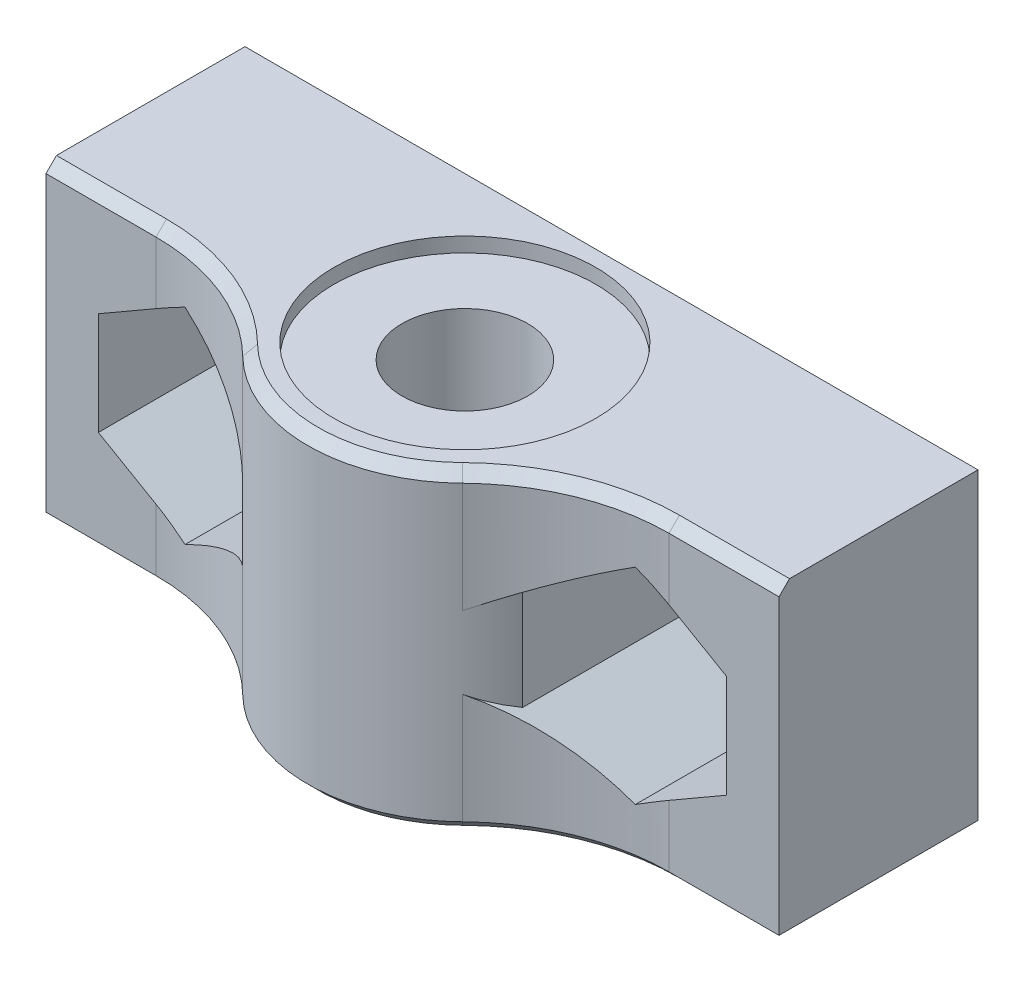
from build123d import *

# Parameters (mm, degrees)
SKETCH1_W           = 35
SKETCH1_H           = 15
BOSS_EXTRUDE1_DEPTH = 10
SKETCH3_R           = 7.5
BOSS_EXTRUDE2_DEPTH = 15
CUT_EXTRUDE1_START  = -7.5
CUT_EXTRUDE1_DEPTH  = 17.5
SKETCH5_R           = 2.75
CUT_EXTRUDE3_DEPTH  = 27.220221204
SKETCH4_R           = 3
CUT_EXTRUDE2_DEPTH  = 28.5
FILLET1_R           = 10
SKETCH6_R           = 6.25
CUT_EXTRUDE4_DEPTH  = 0.7
CUT_EXTRUDE5_START  = -14.3
SKETCH6_3_R         = 6.25
CUT_EXTRUDE5_DEPTH  = 0.7
CHAMFER1_SIZE       = 0.5


with BuildPart() as part:
    # Sketch1 → Boss-Extrude1 (new body)
    with BuildSketch(Plane.XY):
        with Locations((0, -7.5)):
            Rectangle(SKETCH1_W, SKETCH1_H)
    extrude(amount=BOSS_EXTRUDE1_DEPTH)

    # Sketch3 → Boss-Extrude2 (add, through all)
    with BuildSketch(Plane(origin=(0, 0, 0), x_dir=(1, 0, 0), z_dir=(0, 1, 0))):
        with Locations((0, -7.5)):
            Circle(SKETCH3_R)
    extrude(amount=-BOSS_EXTRUDE2_DEPTH)

    # Sketch2 → Cut-Extrude1 (cut)
    with BuildSketch(Plane.XY.offset(10).offset(CUT_EXTRUDE1_START)):
        Polygon((-10.75, -12.407477288), (-6.5, -9.953738644), (-6.5, -5.046261356), (-10.75, -2.592522712), (-15, -5.046261356), (-15, -9.953738644), align=None)
    cut_extrude1 = extrude(amount=CUT_EXTRUDE1_DEPTH, mode=Mode.SUBTRACT)

    # Sketch5 → Cut-Extrude3 (cut, through all)
    with BuildSketch(Plane.XY.offset(2.5)):
        with Locations((-10.75, -7.5)):
            Circle(SKETCH5_R)
    cut_extrude3 = extrude(amount=-CUT_EXTRUDE3_DEPTH, mode=Mode.SUBTRACT)

    # Mirror1: Cut-Extrude1, Cut-Extrude3 across plane
    add(cut_extrude1.mirror(Plane(origin=(0, 0, 0), x_dir=(0, 0, 1), z_dir=(1, 0, 0))), mode=Mode.SUBTRACT)
    add(cut_extrude3.mirror(Plane(origin=(0, 0, 0), x_dir=(0, 0, 1), z_dir=(1, 0, 0))), mode=Mode.SUBTRACT)

    # Sketch4 → Cut-Extrude2 (cut, through all)
    with BuildSketch(Plane(origin=(0, 0, 0), x_dir=(1, 0, 0), z_dir=(0, 1, 0))):
        with Locations(Location((0, -7.5, 0), (0, 0, 180))):
            Circle(SKETCH4_R)
    extrude(amount=-CUT_EXTRUDE2_DEPTH, mode=Mode.SUBTRACT)

    # Fillet1
    # the kernel refuses this fillet: 10 mm, written as the material it adds along each edge
    with BuildSketch(Plane(origin=(7.071067812, -17.657507456, 10), x_dir=(-0.5377110557824625, 0, 0.8431291837490323), z_dir=(0, 1, 0))) as fillet1_piece_1_section:
        with BuildLine():
            CenterArc((5.647894598, 9.741468363), FILLET1_R, 212.527956019, 44.415308597)
            Line((-2.78339724, 4.364357805), (0, 0))
            ThreePointArc((0, 0), (1.694368379, 0.193898728), (3.388736759, 0))
        make_face()
    fillet1_piece_1 = extrude(amount=30.598459711, mode=Mode.PRIVATE)
    fillet1_piece_1 = split(fillet1_piece_1, bisect_by=Plane(origin=(6.425815385, -15, 11.617899052), z_dir=(0, 1, 0)), keep=Keep.TOP, mode=Mode.PRIVATE)
    fillet1_piece_1 = split(fillet1_piece_1, bisect_by=Plane(origin=(8.608682251, -11.17118691, 11.617899052), z_dir=(-0.49999999999999994, -0.8660254037844389, 0)), keep=Keep.TOP, mode=Mode.PRIVATE)
    add(fillet1_piece_1)
    with BuildSketch(Plane(origin=(7.071067812, -17.657507456, 10), x_dir=(-0.5377110557824625, 0, 0.8431291837490323), z_dir=(0, 1, 0))) as fillet1_piece_2_section:
        with BuildLine():
            CenterArc((5.647894598, 9.741468363), FILLET1_R, 212.527956019, 44.415308597)
            Line((-2.78339724, 4.364357805), (0, 0))
            ThreePointArc((0, 0), (1.694368379, 0.193898728), (3.388736759, 0))
        make_face()
    fillet1_piece_2 = extrude(amount=30.598459711, mode=Mode.PRIVATE)
    fillet1_piece_2 = split(fillet1_piece_2, bisect_by=Plane(origin=(11.198944739, -12.666675654, 10.022508618), z_dir=(0.49999999999999994, 0.8660254037844389, 0)), keep=Keep.TOP, mode=Mode.PRIVATE)
    fillet1_piece_2 = split(fillet1_piece_2, bisect_by=Plane(origin=(11.198944739, -12.148278922, 10.022508618), z_dir=(0.49999999999999994, -0.8660254037844389, 0)), keep=Keep.TOP, mode=Mode.PRIVATE)
    add(fillet1_piece_2)
    with BuildSketch(Plane(origin=(7.071067812, -17.657507456, 10), x_dir=(-0.5377110557824625, 0, 0.8431291837490323), z_dir=(0, 1, 0))) as fillet1_piece_3_section:
        with BuildLine():
            CenterArc((5.647894598, 9.741468363), FILLET1_R, 212.527956019, 44.415308597)
            Line((-2.78339724, 4.364357805), (0, 0))
            ThreePointArc((0, 0), (1.694368379, 0.193898728), (3.388736759, 0))
        make_face()
    fillet1_piece_3 = extrude(amount=17.657507456, mode=Mode.PRIVATE)
    fillet1_piece_3 = split(fillet1_piece_3, bisect_by=Plane(origin=(7.311033897, -4.578010717, 11.885204444), z_dir=(-0.5000000000000009, 0.8660254037844383, 0)), keep=Keep.TOP, mode=Mode.PRIVATE)
    add(fillet1_piece_3)
    with BuildSketch(Plane(origin=(7.071067812, -17.657507456, 10), x_dir=(-0.5377110557824625, 0, 0.8431291837490323), z_dir=(0, 1, 0))) as fillet1_piece_4_section:
        with BuildLine():
            CenterArc((5.647894598, 9.741468363), FILLET1_R, 212.527956019, 44.415308597)
            Line((-2.78339724, 4.364357805), (0, 0))
            ThreePointArc((0, 0), (1.694368379, 0.193898728), (3.388736759, 0))
        make_face()
    fillet1_piece_4 = extrude(amount=30.598459711, mode=Mode.PRIVATE)
    fillet1_piece_4 = split(fillet1_piece_4, bisect_by=Plane(origin=(11.198944739, -2.333324346, 10.022508618), z_dir=(0.5000000000000009, -0.8660254037844383, 0)), keep=Keep.TOP, mode=Mode.PRIVATE)
    fillet1_piece_4 = split(fillet1_piece_4, bisect_by=Plane(origin=(11.198944739, -2.851721078, 10.022508618), z_dir=(0.5000000000000001, 0.8660254037844386, 0)), keep=Keep.TOP, mode=Mode.PRIVATE)
    add(fillet1_piece_4)
    with BuildSketch(Plane(origin=(-7.071067812, -17.657507456, 10), x_dir=(-1, 0, 0), z_dir=(0, 1, 0))) as fillet1_piece_5_section:
        with BuildLine():
            CenterArc((5.176380902, 10), FILLET1_R, 225.584691403, 44.415308597)
            ThreePointArc((-1.82216122, 2.857142857), (-0.747598934, 1.532832918), (0, 0))
            Line((0, 0), (5.176380902, 0))
        make_face()
    fillet1_piece_5 = extrude(amount=30.598459711, mode=Mode.PRIVATE)
    fillet1_piece_5 = split(fillet1_piece_5, bisect_by=Plane(origin=(-8.687576495, -15, 10.380647158), z_dir=(0, 1, 0)), keep=Keep.TOP, mode=Mode.PRIVATE)
    fillet1_piece_5 = split(fillet1_piece_5, bisect_by=Plane(origin=(-10.026133402, -11.989552713, 10.380647158), z_dir=(0.49999999999999994, -0.8660254037844389, 0)), keep=Keep.TOP, mode=Mode.PRIVATE)
    add(fillet1_piece_5)
    with BuildSketch(Plane(origin=(-7.071067812, -17.657507456, 10), x_dir=(-1, 0, 0), z_dir=(0, 1, 0))) as fillet1_piece_6_section:
        with BuildLine():
            CenterArc((5.176380902, 10), FILLET1_R, 225.584691403, 44.415308597)
            ThreePointArc((-1.82216122, 2.857142857), (-0.747598934, 1.532832918), (0, 0))
            Line((0, 0), (5.176380902, 0))
        make_face()
    fillet1_piece_6 = extrude(amount=30.598459711, mode=Mode.PRIVATE)
    fillet1_piece_6 = split(fillet1_piece_6, bisect_by=Plane(origin=(-11.19894474, -12.666675654, 10.022508618), z_dir=(-0.49999999999999994, 0.8660254037844389, 0)), keep=Keep.TOP, mode=Mode.PRIVATE)
    fillet1_piece_6 = split(fillet1_piece_6, bisect_by=Plane(origin=(-11.19894474, -12.148278922, 10.022508618), z_dir=(-0.49999999999999994, -0.8660254037844389, 0)), keep=Keep.TOP, mode=Mode.PRIVATE)
    add(fillet1_piece_6)
    with BuildSketch(Plane(origin=(-7.071067812, -17.657507456, 10), x_dir=(-1, 0, 0), z_dir=(0, 1, 0))) as fillet1_piece_7_section:
        with BuildLine():
            CenterArc((5.176380902, 10), FILLET1_R, 225.584691403, 44.415308597)
            ThreePointArc((-1.82216122, 2.857142857), (-0.747598934, 1.532832918), (0, 0))
            Line((0, 0), (5.176380902, 0))
        make_face()
    fillet1_piece_7 = extrude(amount=17.657507456, mode=Mode.PRIVATE)
    fillet1_piece_7 = split(fillet1_piece_7, bisect_by=Plane(origin=(-8.42018253, -3.937643455, 10.662510622), z_dir=(0.5000000000000009, 0.8660254037844383, 0)), keep=Keep.TOP, mode=Mode.PRIVATE)
    add(fillet1_piece_7)
    with BuildSketch(Plane(origin=(-7.071067812, -17.657507456, 10), x_dir=(-1, 0, 0), z_dir=(0, 1, 0))) as fillet1_piece_8_section:
        with BuildLine():
            CenterArc((5.176380902, 10), FILLET1_R, 225.584691403, 44.415308597)
            ThreePointArc((-1.82216122, 2.857142857), (-0.747598934, 1.532832918), (0, 0))
            Line((0, 0), (5.176380902, 0))
        make_face()
    fillet1_piece_8 = extrude(amount=30.598459711, mode=Mode.PRIVATE)
    fillet1_piece_8 = split(fillet1_piece_8, bisect_by=Plane(origin=(-11.19894474, -2.851721078, 10.022508618), z_dir=(-0.5000000000000001, 0.8660254037844386, 0)), keep=Keep.TOP, mode=Mode.PRIVATE)
    fillet1_piece_8 = split(fillet1_piece_8, bisect_by=Plane(origin=(-11.19894474, -2.333324346, 10.022508618), z_dir=(-0.5000000000000009, -0.8660254037844383, 0)), keep=Keep.TOP, mode=Mode.PRIVATE)
    add(fillet1_piece_8)
    with BuildSketch(Plane(origin=(-7.071067812, -15, 10), x_dir=(-1, 0, 0), z_dir=(0, 1, 0))) as fillet1_piece_9_section:
        with BuildLine():
            CenterArc((5.176380902, 10), FILLET1_R, 225.584691403, 44.415308597)
            ThreePointArc((-1.82216122, 2.857142857), (-0.747598934, 1.532832918), (0, 0))
            Line((0, 0), (5.176380902, 0))
        make_face()
    fillet1_piece_9 = extrude(amount=17.657507456, mode=Mode.PRIVATE)
    fillet1_piece_9 = split(fillet1_piece_9, bisect_by=Plane(origin=(-10.026133402, -11.989552713, 10.380647158), z_dir=(0.49999999999999994, -0.8660254037844389, 0)), keep=Keep.TOP, mode=Mode.PRIVATE)
    add(fillet1_piece_9)
    with BuildSketch(Plane(origin=(-7.071067812, -27.940952255, 10), x_dir=(-1, 0, 0), z_dir=(0, 1, 0))) as fillet1_piece_10_section:
        with BuildLine():
            CenterArc((5.176380902, 10), FILLET1_R, 225.584691403, 44.415308597)
            ThreePointArc((-1.82216122, 2.857142857), (-0.747598934, 1.532832918), (0, 0))
            Line((0, 0), (5.176380902, 0))
        make_face()
    fillet1_piece_10 = extrude(amount=30.598459711, mode=Mode.PRIVATE)
    fillet1_piece_10 = split(fillet1_piece_10, bisect_by=Plane(origin=(-11.19894474, -12.666675654, 10.022508618), z_dir=(-0.49999999999999994, 0.8660254037844389, 0)), keep=Keep.TOP, mode=Mode.PRIVATE)
    fillet1_piece_10 = split(fillet1_piece_10, bisect_by=Plane(origin=(-11.19894474, -12.148278922, 10.022508618), z_dir=(-0.49999999999999994, -0.8660254037844389, 0)), keep=Keep.TOP, mode=Mode.PRIVATE)
    add(fillet1_piece_10)
    with BuildSketch(Plane(origin=(-7.071067812, -27.940952255, 10), x_dir=(-1, 0, 0), z_dir=(0, 1, 0))) as fillet1_piece_11_section:
        with BuildLine():
            CenterArc((5.176380902, 10), FILLET1_R, 225.584691403, 44.415308597)
            ThreePointArc((-1.82216122, 2.857142857), (-0.747598934, 1.532832918), (0, 0))
            Line((0, 0), (5.176380902, 0))
        make_face()
    fillet1_piece_11 = extrude(amount=30.598459711, mode=Mode.PRIVATE)
    fillet1_piece_11 = split(fillet1_piece_11, bisect_by=Plane(origin=(-7.643576707, 0, 10.662510622), z_dir=(0, -1, 0)), keep=Keep.TOP, mode=Mode.PRIVATE)
    fillet1_piece_11 = split(fillet1_piece_11, bisect_by=Plane(origin=(-8.42018253, -3.937643455, 10.662510622), z_dir=(0.5000000000000009, 0.8660254037844383, 0)), keep=Keep.TOP, mode=Mode.PRIVATE)
    add(fillet1_piece_11)
    with BuildSketch(Plane(origin=(-7.071067812, -27.940952255, 10), x_dir=(-1, 0, 0), z_dir=(0, 1, 0))) as fillet1_piece_12_section:
        with BuildLine():
            CenterArc((5.176380902, 10), FILLET1_R, 225.584691403, 44.415308597)
            ThreePointArc((-1.82216122, 2.857142857), (-0.747598934, 1.532832918), (0, 0))
            Line((0, 0), (5.176380902, 0))
        make_face()
    fillet1_piece_12 = extrude(amount=30.598459711, mode=Mode.PRIVATE)
    fillet1_piece_12 = split(fillet1_piece_12, bisect_by=Plane(origin=(-11.19894474, -2.851721078, 10.022508618), z_dir=(-0.5000000000000001, 0.8660254037844386, 0)), keep=Keep.TOP, mode=Mode.PRIVATE)
    fillet1_piece_12 = split(fillet1_piece_12, bisect_by=Plane(origin=(-11.19894474, -2.333324346, 10.022508618), z_dir=(-0.5000000000000009, -0.8660254037844383, 0)), keep=Keep.TOP, mode=Mode.PRIVATE)
    add(fillet1_piece_12)
    with BuildSketch(Plane(origin=(7.071067812, -15, 10), x_dir=(-0.537711055782462, 0, 0.8431291837490327), z_dir=(0, 1, 0))) as fillet1_piece_13_section:
        with BuildLine():
            CenterArc((5.647894598, 9.741468363), FILLET1_R, 212.527956019, 44.415308597)
            Line((-2.78339724, 4.364357805), (0, 0))
            ThreePointArc((0, 0), (1.694368379, 0.193898728), (3.388736759, 0))
        make_face()
    fillet1_piece_13 = extrude(amount=17.657507456, mode=Mode.PRIVATE)
    fillet1_piece_13 = split(fillet1_piece_13, bisect_by=Plane(origin=(8.608682251, -11.17118691, 11.617899052), z_dir=(-0.49999999999999994, -0.8660254037844389, 0)), keep=Keep.TOP, mode=Mode.PRIVATE)
    add(fillet1_piece_13)
    with BuildSketch(Plane(origin=(7.071067812, -27.940952255, 10), x_dir=(-0.5377110557824618, 0, 0.8431291837490328), z_dir=(0, 1, 0))) as fillet1_piece_14_section:
        with BuildLine():
            CenterArc((5.647894598, 9.741468363), FILLET1_R, 212.527956019, 44.415308597)
            Line((-2.78339724, 4.364357805), (0, 0))
            ThreePointArc((0, 0), (1.694368379, 0.193898728), (3.388736759, 0))
        make_face()
    fillet1_piece_14 = extrude(amount=30.598459711, mode=Mode.PRIVATE)
    fillet1_piece_14 = split(fillet1_piece_14, bisect_by=Plane(origin=(11.198944739, -12.666675654, 10.022508618), z_dir=(0.49999999999999994, 0.8660254037844389, 0)), keep=Keep.TOP, mode=Mode.PRIVATE)
    fillet1_piece_14 = split(fillet1_piece_14, bisect_by=Plane(origin=(11.198944739, -12.148278922, 10.022508618), z_dir=(0.49999999999999994, -0.8660254037844389, 0)), keep=Keep.TOP, mode=Mode.PRIVATE)
    add(fillet1_piece_14)
    with BuildSketch(Plane(origin=(7.071067812, -27.940952255, 10), x_dir=(-0.5377110557824618, 0, 0.8431291837490328), z_dir=(0, 1, 0))) as fillet1_piece_15_section:
        with BuildLine():
            CenterArc((5.647894598, 9.741468363), FILLET1_R, 212.527956019, 44.415308597)
            Line((-2.78339724, 4.364357805), (0, 0))
            ThreePointArc((0, 0), (1.694368379, 0.193898728), (3.388736759, 0))
        make_face()
    fillet1_piece_15 = extrude(amount=30.598459711, mode=Mode.PRIVATE)
    fillet1_piece_15 = split(fillet1_piece_15, bisect_by=Plane(origin=(6.186931612, 0, 11.885204444), z_dir=(0, -1, 0)), keep=Keep.TOP, mode=Mode.PRIVATE)
    fillet1_piece_15 = split(fillet1_piece_15, bisect_by=Plane(origin=(7.311033897, -4.578010717, 11.885204444), z_dir=(-0.5000000000000009, 0.8660254037844383, 0)), keep=Keep.TOP, mode=Mode.PRIVATE)
    add(fillet1_piece_15)
    with BuildSketch(Plane(origin=(7.071067812, -27.940952255, 10), x_dir=(-0.5377110557824618, 0, 0.8431291837490328), z_dir=(0, 1, 0))) as fillet1_piece_16_section:
        with BuildLine():
            CenterArc((5.647894598, 9.741468363), FILLET1_R, 212.527956019, 44.415308597)
            Line((-2.78339724, 4.364357805), (0, 0))
            ThreePointArc((0, 0), (1.694368379, 0.193898728), (3.388736759, 0))
        make_face()
    fillet1_piece_16 = extrude(amount=30.598459711, mode=Mode.PRIVATE)
    fillet1_piece_16 = split(fillet1_piece_16, bisect_by=Plane(origin=(11.198944739, -2.333324346, 10.022508618), z_dir=(0.5000000000000009, -0.8660254037844383, 0)), keep=Keep.TOP, mode=Mode.PRIVATE)
    fillet1_piece_16 = split(fillet1_piece_16, bisect_by=Plane(origin=(11.198944739, -2.851721078, 10.022508618), z_dir=(0.5000000000000001, 0.8660254037844386, 0)), keep=Keep.TOP, mode=Mode.PRIVATE)
    add(fillet1_piece_16)

    # Sketch6 → Cut-Extrude4 (cut)
    with BuildSketch(Plane.XZ.offset(15)):
        with Locations((0, 7.5)):
            Circle(SKETCH6_R)
    extrude(amount=-CUT_EXTRUDE4_DEPTH, mode=Mode.SUBTRACT)

    # Sketch6<3> → Cut-Extrude5 (cut)
    with BuildSketch(Plane.XZ.offset(15).offset(CUT_EXTRUDE5_START)):
        with Locations((0, 7.5)):
            Circle(SKETCH6_3_R)
    extrude(amount=-CUT_EXTRUDE5_DEPTH, mode=Mode.SUBTRACT)

    # Chamfer1
    chamfer1_edges = [part.edges().sort_by_distance(p)[0] for p in [
        (8.467803984, 0, 10.741799002),
        (8.467803984, -15, 10.741799002),
        (-8.467803984, -15, 10.741799002),
        (-8.467803984, 0, 10.741799002),
        (14.873724357, 0, 10),
        (0, 0, 0),
        (17.5, -7.5, 0),
        (0, -15, 0),
        (-13.5, -7.5, 0),
        (-17.5, -7.5, 0),
        (-14.873724357, -15, 10),
        (17.5, -15, 5),
        (-17.5, -15, 5),
        (13.5, -7.5, 0),
        (0, 0, 15),
        (0, -15, 15),
        (14.873724357, -15, 10),
        (-14.873724357, 0, 10),
    ]]
    chamfer(chamfer1_edges, length=CHAMFER1_SIZE)


solid = part.part
